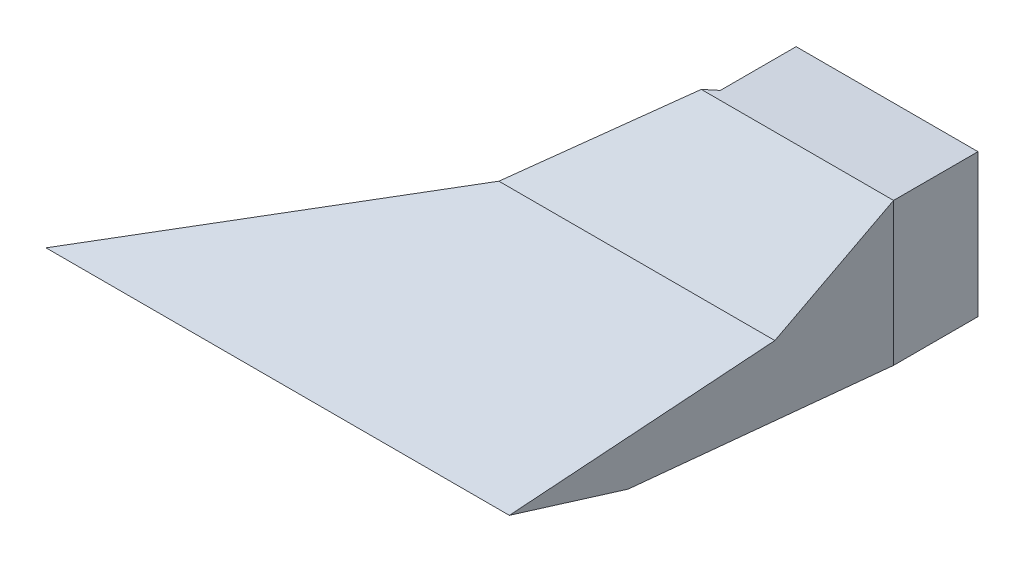
from build123d import *

# Parameters (mm, degrees)
SIDE_BASE_DEPTH                    = 0.8
SIDE_BASE_2_COUNT                  = 2
SIDE_BASE_2_PITCH                  = 50
FRONT_BACK_WALLS_REACH             = 60.566
BASE_SKETCH_W                      = 50.8
BASE_SKETCH_H                      = 13.2
BASE_SKETCH_W_2                    = 15.2
BASE_SKETCH_H_2                    = 11.276834123
BASE_DEPTH                         = 0.8
ATTACHMENT_BASE_SKETCH_W           = 16.8
ATTACHMENT_BASE_SKETCH_H           = 13.2
ATTACHMENT_BASE_SKETCH_W_2         = 15.2
ATTACHMENT_BASE_SKETCH_H_2         = 11.276834123
ATTACHMENT_BASE_DEPTH              = 7
SKETCH1_W                          = 15.2
SKETCH1_H                          = 11.276834123
FAN_BASE_DEPTH                     = 0.1
LEFT_RIGHT_WALL_REMOVAL_DEPTH      = 59.566323483
LEFT_RIGHT_WALL_REMOVAL_DEPTH_BACK = 59.566323483
SKETCH6_W                          = 28.631700026
SKETCH6_H                          = 16.366666667
CUTAWAY_LEFT_DEPTH                 = 54.208577359
LEFT_WALL_DEPTH                    = 0.8331843
SKETCH9_W                          = 44.231215268
SKETCH9_H                          = 16.366666667
CUTAWAY_RIGHT_DEPTH                = 47.338131648
RIGHT_WALL_DEPTH                   = 1.25073473
PIPE_TOP_EXTRA_CUTAWAY_REACH       = 65.248
SKETCH11_W                         = 15.2
SKETCH11_H                         = 0.312130873


with BuildPart() as part:
    # Side base sketch → Side base (new body)
    with BuildSketch(Plane.ZY):
        Polygon((0, 13.2), (8.491348573, 5), (19.491348573, 0.8030407), (27.491348573, -2.249293336), (19, -3.166666667), (6, -1), (0, 0), align=None)
    extrude(amount=-SIDE_BASE_DEPTH)


with BuildPart() as side_base_2_1:
    # Side base 2: pattern copy
    add(part.part.moved(Location(Vector(1, 0, 0) * (1 * SIDE_BASE_2_PITCH))))

    # Wall base sketch → Front back walls (add, up to next)
    with BuildSketch(Plane(origin=(0.8, 0, 0), x_dir=(0, 0, -1), z_dir=(1, 0, 0)), mode=Mode.PRIVATE) as front_back_walls_sk1:
        Polygon((0, 12.087869127), (-8.053310036, 4.310878025), (-25.742389296, -2.438244311), (-27.491348573, -2.249293336), (-8.491348573, 5), (0, 13.2), align=None)
    front_back_walls_tool1 = extrude(front_back_walls_sk1.sketch, amount=FRONT_BACK_WALLS_REACH, mode=Mode.PRIVATE) - side_base_2_1.part
    # Wall base sketch → Front back walls (add, up to next)
    with BuildSketch(Plane(origin=(0.8, 0, 0), x_dir=(0, 0, -1), z_dir=(1, 0, 0)), mode=Mode.PRIVATE) as front_back_walls_sk2:
        Polygon((0, 0.811035004), (-19, -2.355631663), (-19, -3.166666667), (0, 0), align=None)
    front_back_walls_tool2 = extrude(front_back_walls_sk2.sketch, amount=FRONT_BACK_WALLS_REACH, mode=Mode.PRIVATE) - side_base_2_1.part

    add(part.part)  # Front back walls merges part
    add(front_back_walls_tool1.solids().sort_by_distance((0.8, 8.426886, 4.246361))[0])
    add(front_back_walls_tool2.solids().sort_by_distance((0.8, -1.177816, 9.5))[0])

    # Base sketch → Base (add)
    with BuildSketch(Plane(origin=(0, 0, 0), x_dir=(-1, 0, 0), z_dir=(0, 0, -1))):
        with Locations((-25.4, 6.6)):
            Rectangle(BASE_SKETCH_W, BASE_SKETCH_H)
        with Locations((-42.4, 6.449452066)):
            Rectangle(BASE_SKETCH_W_2, BASE_SKETCH_H_2, mode=Mode.SUBTRACT)
    extrude(amount=BASE_DEPTH)

    # Attachment base sketch → Attachment base (add)
    with BuildSketch(Plane(origin=(0, 0, -0.8), x_dir=(-1, 0, 0), z_dir=(0, 0, -1))):
        with Locations((-42.4, 6.6)):
            Rectangle(ATTACHMENT_BASE_SKETCH_W, ATTACHMENT_BASE_SKETCH_H)
        with Locations((-42.4, 6.449452066)):
            Rectangle(ATTACHMENT_BASE_SKETCH_W_2, ATTACHMENT_BASE_SKETCH_H_2, mode=Mode.SUBTRACT)
    extrude(amount=ATTACHMENT_BASE_DEPTH)

    # Sketch4 → Left right wall removal (cut, two sides: drawn at the far end of the back side and taken through both)
    with BuildSketch(Plane(origin=(0.8, 0, 0), x_dir=(0, 0, -1), z_dir=(1, 0, 0)).offset(-LEFT_RIGHT_WALL_REMOVAL_DEPTH_BACK)):
        Polygon((-25.742389296, -2.438244311), (-19, -3.166666667), (-19, -2.355631663), (0, 0.811035004), (0, 12.087869127), (-8.053310036, 4.310878025), align=None)
    extrude(amount=LEFT_RIGHT_WALL_REMOVAL_DEPTH + LEFT_RIGHT_WALL_REMOVAL_DEPTH_BACK, mode=Mode.SUBTRACT)

    # Sketch6 → Cutaway left (cut, through all)
    with BuildSketch(Plane(origin=(46.834030083, 0, 13.628732678), x_dir=(0.27941058312270783, 0, -0.9601717169543313), z_dir=(0.9601717169543312, 0, 0.2794105831227078))):
        with Locations((-0.12179239, 5.016666667)):
            Rectangle(SKETCH6_W, SKETCH6_H)
    extrude(amount=CUTAWAY_LEFT_DEPTH, mode=Mode.SUBTRACT)

    # Sketch7 → Left wall (add, along a direction that is not the sketch's normal)
    with BuildSketch(Plane(origin=(46.834030083, 0, 13.628732678), x_dir=(0.27941058312270806, 0, -0.9601717169543312), z_dir=(0.9601717169543312, 0, 0.27941058312270806))):
        Polygon((-5.594069506, -2.355631663), (-5.594069506, -3.166666667), (-12.616135639, -2.438244311), (5.806693265, 4.310878025), (14.194057623, 12.087869127), (14.194057623, 0.811035004), align=None)
    extrude(amount=-LEFT_WALL_DEPTH, dir=(1, 0, 0))

    # Sketch9 → Cutaway right (cut, through all)
    with BuildSketch(Plane(origin=(13.516705988, 0, 16.244117965), x_dir=(0.7686879004792403, 0, -0.6396240393049794), z_dir=(0.6396240393049794, -1.3449343476138912e-15, 0.7686879004792403))):
        with Locations((4.531480214, 5.016666667)):
            Rectangle(SKETCH9_W, SKETCH9_H)
    extrude(amount=-CUTAWAY_RIGHT_DEPTH, mode=Mode.SUBTRACT)

    # Sketch10 → Right wall (add, along a direction that is not the sketch's normal)
    with BuildSketch(Plane(origin=(13.516705988, 0, 16.244117965), x_dir=(-0.7686879004792402, -2.570451750162017e-15, 0.6396240393049794), z_dir=(-0.6396240393049794, 1.2488685157059335e-15, -0.7686879004792402))):
        Polygon((-25.396353118, 12.087869127), (-25.396353118, 0.811035004), (4.308596716, -2.355631663), (4.308596716, -3.166666667), (14.849772284, -2.438244311), (-12.805659927, 4.310878025), align=None)
    extrude(amount=-RIGHT_WALL_DEPTH, dir=(-1, 0, 0))

    # Pipe top extra cutaway: up to this plane
    pipe_top_extra_cutaway_end = Plane(origin=(500000, 12.087869127, 0), z_dir=(0, 0.7193398003386523, 0.6946583704589961))
    # Sketch11 → Pipe top extra cutaway (cut, up to the surface)
    with BuildSketch(Plane(origin=(0, 0, -7.8), x_dir=(-1, 0, 0), z_dir=(0, 0, -1)), mode=Mode.PRIVATE) as pipe_top_extra_cutaway_sk1:
        with Locations((-42.4, 12.243934564)):
            Rectangle(SKETCH11_W, SKETCH11_H)
    pipe_top_extra_cutaway_tool1 = split(extrude(pipe_top_extra_cutaway_sk1.sketch, amount=-PIPE_TOP_EXTRA_CUTAWAY_REACH, mode=Mode.PRIVATE), bisect_by=pipe_top_extra_cutaway_end, keep=Keep.BOTH, mode=Mode.PRIVATE)
    add(pipe_top_extra_cutaway_tool1.solids().sort_by_distance((42.4, 12.243935, -7.8))[0], mode=Mode.SUBTRACT)


with BuildPart() as body_2:
    # Sketch1 → Fan base (new body)
    with BuildSketch(Plane(origin=(0, 0, -7.8), x_dir=(-1, 0, 0), z_dir=(0, 0, -1))):
        with Locations((-42.4, 6.449452066)):
            Rectangle(SKETCH1_W, SKETCH1_H)
    extrude(amount=FAN_BASE_DEPTH)


solid = Compound([side_base_2_1.part, body_2.part])
